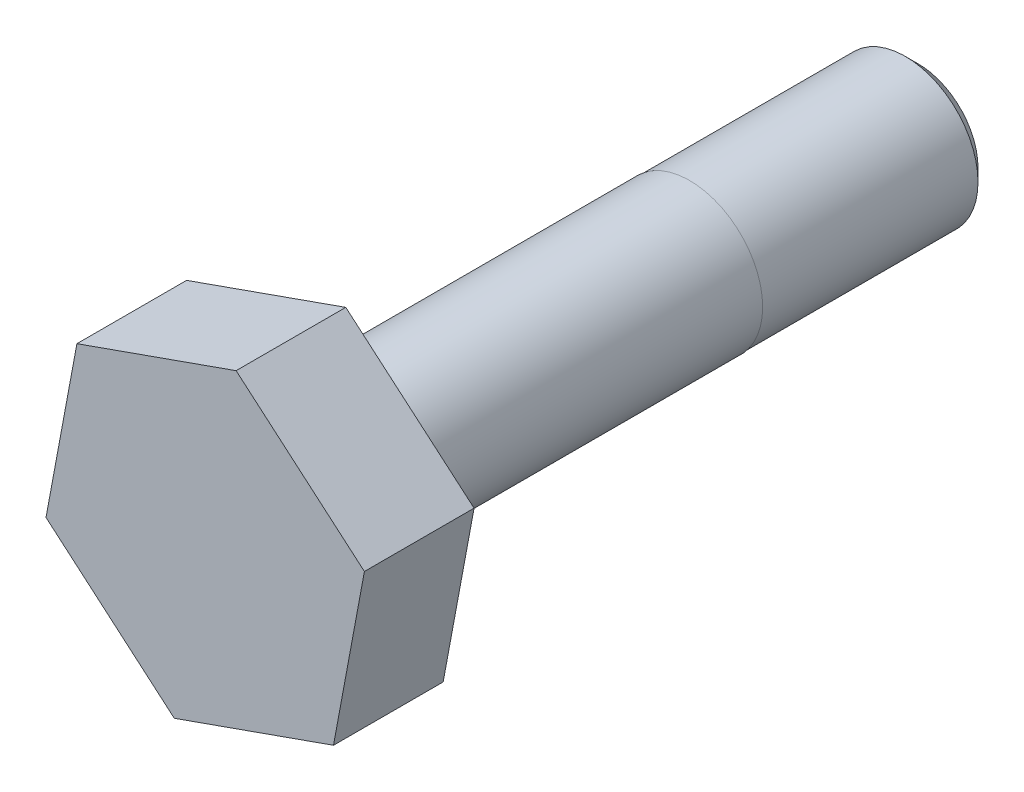
from build123d import *

# Parameters (mm, degrees)
BOSS_EXTRUDE1_DEPTH = 12
SKETCH4_R           = 8
BOSS_EXTRUDE3_DEPTH = 66


# Read off the part's stored shape, not the designer's step: 5/8-11 Machine Threads Stud2
with BuildPart() as part:
    # Sketch1 → Boss-Extrude1 (new body)
    with BuildSketch(Plane.XY):
        Polygon((0, 0), (3.38231859, 18.162963808), (-10.656110181, 30.173619534), (-28.076857542, 24.021311453), (-31.459176132, 5.858347645), (-17.420747361, -6.152308082), align=None)
    extrude(amount=BOSS_EXTRUDE1_DEPTH)

    # Sketch4 → Boss-Extrude3 (add)
    with BuildSketch(Plane(origin=(0, 0, 0), x_dir=(-1, 0, 0), z_dir=(0, 0, -1))):
        with Locations((14.038428771, 12.010655726)):
            Circle(SKETCH4_R)
    extrude(amount=BOSS_EXTRUDE3_DEPTH)

    # 5/8-11 Machine Threads Stud2 outline → 5/8-11 Machine Threads Stud2 (revolve, cut)
    with BuildSketch(Plane(origin=(-14.038428771, 12.010655726, 0), x_dir=(1, 0, 0), z_dir=(0, -1, 0))):
        Polygon((6.56336, -66), (8, -66), (8, -41), (7.9375, -41), (7.9375, -64.62586), align=None)
    revolve(axis=Axis((-14.038428771, 12.010655726, 0), (0, 0, 1)), mode=Mode.SUBTRACT)


solid = part.part
